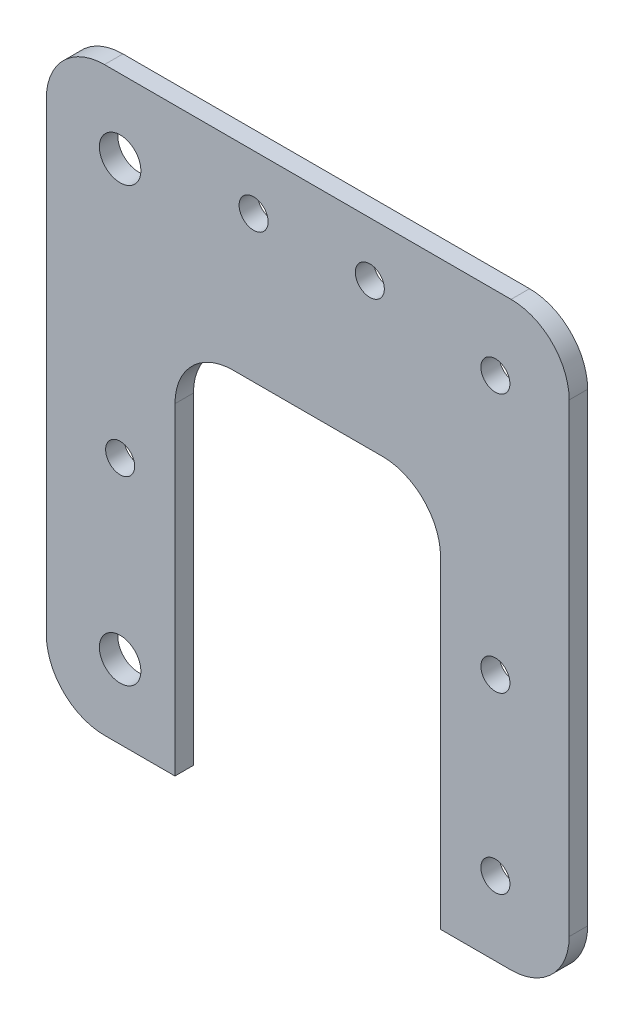
from build123d import *

# Parameters (mm, degrees)
BOSS_EXTRUDE1_START = 19.16
SKETCH1_W           = 90
SKETCH1_H           = 100
SKETCH1_R           = 2.5
SKETCH1_R_2         = 3.57
BOSS_EXTRUDE1_DEPTH = 3.18
SKETCH2_W           = 45.72
SKETCH2_H           = 65.511870912
CUT_EXTRUDE1_DEPTH  = 72.134467033
FILLET1_R           = 10
SKETCH3_R           = 2.5
CUT_EXTRUDE2_DEPTH  = 72.134467033


with BuildPart() as part:
    # Sketch1 → Boss-Extrude1 (new body)
    with BuildSketch(Plane.XY.offset(BOSS_EXTRUDE1_START)):
        with Locations((0, -5)):
            Rectangle(SKETCH1_W, SKETCH1_H)
        with Locations((32.3, -12.3)):
            Circle(SKETCH1_R, mode=Mode.SUBTRACT)
        with Locations((32.3, -42.3)):
            Circle(SKETCH1_R, mode=Mode.SUBTRACT)
        with Locations((-32.3, -42.3)):
            Circle(SKETCH1_R_2, mode=Mode.SUBTRACT)
        with Locations((-32.3, -12.3)):
            Circle(SKETCH1_R, mode=Mode.SUBTRACT)
        with Locations((-32.3, 32.3)):
            Circle(SKETCH1_R_2, mode=Mode.SUBTRACT)
        with Locations((32.3, 32.3)):
            Circle(SKETCH1_R, mode=Mode.SUBTRACT)
    extrude(amount=-BOSS_EXTRUDE1_DEPTH)

    # Sketch2 → Cut-Extrude1 (cut, through all)
    with BuildSketch(Plane(origin=(0, 0, 15.98), x_dir=(-1, 0, 0), z_dir=(0, 0, -1))):
        with Locations((0, -22.244064544)):
            Rectangle(SKETCH2_W, SKETCH2_H)
    extrude(amount=-CUT_EXTRUDE1_DEPTH, mode=Mode.SUBTRACT)

    # Fillet1
    fillet1_edges = [part.edges().sort_by_distance(p)[0] for p in [
        (45, -55, 17.57),
        (-45, -55, 17.57),
        (-45, 45, 17.57),
        (45, 45, 17.57),
        (-22.86, 10.511870912, 17.57),
        (22.86, 10.511870912, 17.57),
    ]]
    fillet(fillet1_edges, radius=FILLET1_R)

    # Sketch3 → Cut-Extrude2 (cut, through all)
    with BuildSketch(Plane.XY.offset(19.16)):
        with Locations((10.681555237, 35.634029568)):
            Circle(SKETCH3_R)
        with Locations((-9.318444763, 35.634029568)):
            Circle(SKETCH3_R)
    extrude(amount=-CUT_EXTRUDE2_DEPTH, mode=Mode.SUBTRACT)


solid = part.part
